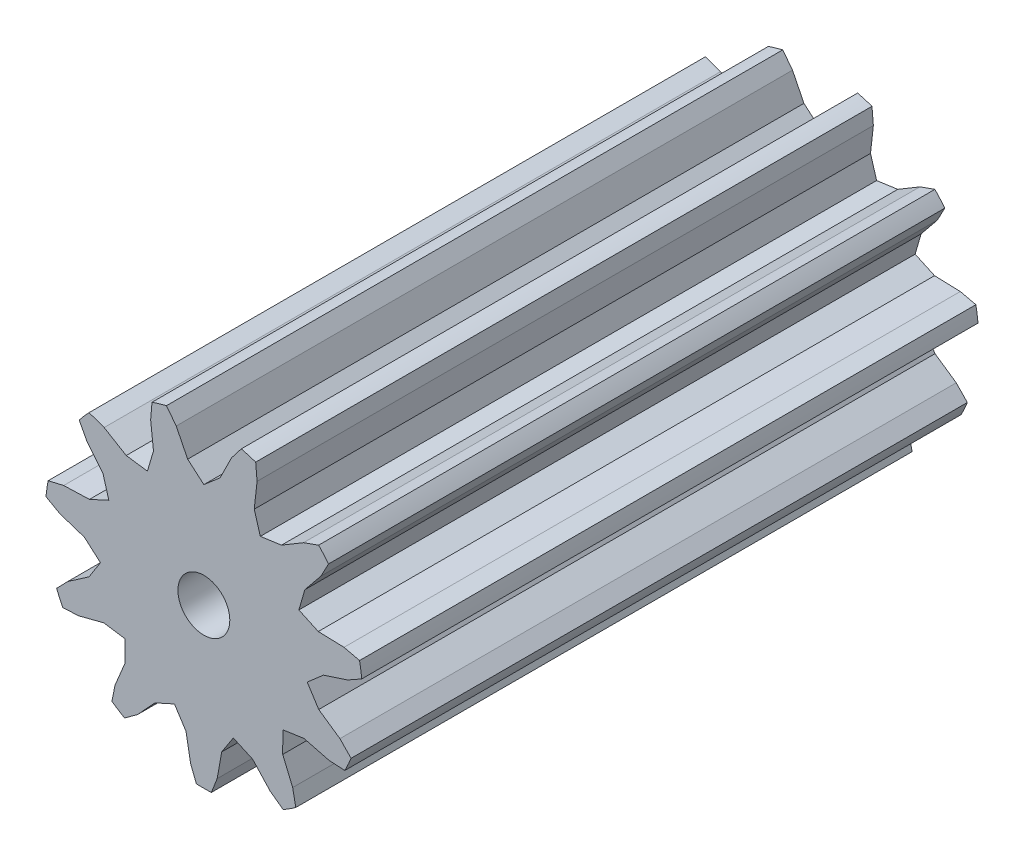
from build123d import *

# Parameters (mm, degrees)
SKETCH1_R               = 9.7778
BOSS_EXTRUDE1_DEPTH     = 38
CUT_EXTRUDE1_DEPTH      = 41.437739127
CUT_EXTRUDE2_DEPTH      = 41.437739127
CUT_EXTRUDE2_DEPTH_BACK = 41.437739127
SKETCH4_R               = 1.6
CIRPATTERN1_COUNT       = 11


with BuildPart() as part:
    # Sketch1 → Boss-Extrude1 (new body)
    with BuildSketch(Plane.XY):
        Circle(SKETCH1_R)
    extrude(amount=BOSS_EXTRUDE1_DEPTH)

    # Sketch2 → Cut-Extrude1 (cut, through all)
    with BuildSketch(Plane.XY):
        Polygon((0, 6.440231992), (-0.998470792, 7.29965938), (-1.704297747, 8.720724317), (-2.306603416, 9.501839481), (-1.704297747, 10.285038999), (0, 10.999278518), (1.704297747, 10.285038999), (2.306603416, 9.501839481), (1.704297747, 8.720724317), (0.998470792, 7.29965938), align=None)
    cut_extrude1 = extrude(amount=CUT_EXTRUDE1_DEPTH, mode=Mode.SUBTRACT)

    # Sketch4 → Cut-Extrude2 (cut, two sides: drawn at the far end of the back side and taken through both)
    with BuildSketch(Plane.XY.offset(38).offset(-CUT_EXTRUDE2_DEPTH_BACK)):
        Circle(SKETCH4_R)
    extrude(amount=CUT_EXTRUDE2_DEPTH + CUT_EXTRUDE2_DEPTH_BACK, mode=Mode.SUBTRACT)

    # CirPattern1: Cut-Extrude1 ×11 about axis
    cirpattern1_axis = Axis((0, 0, 38), (0, 0, -1))
    for i in range(1, CIRPATTERN1_COUNT):
        add(cut_extrude1.rotate(cirpattern1_axis, i * 360 / CIRPATTERN1_COUNT), mode=Mode.SUBTRACT)


solid = part.part
